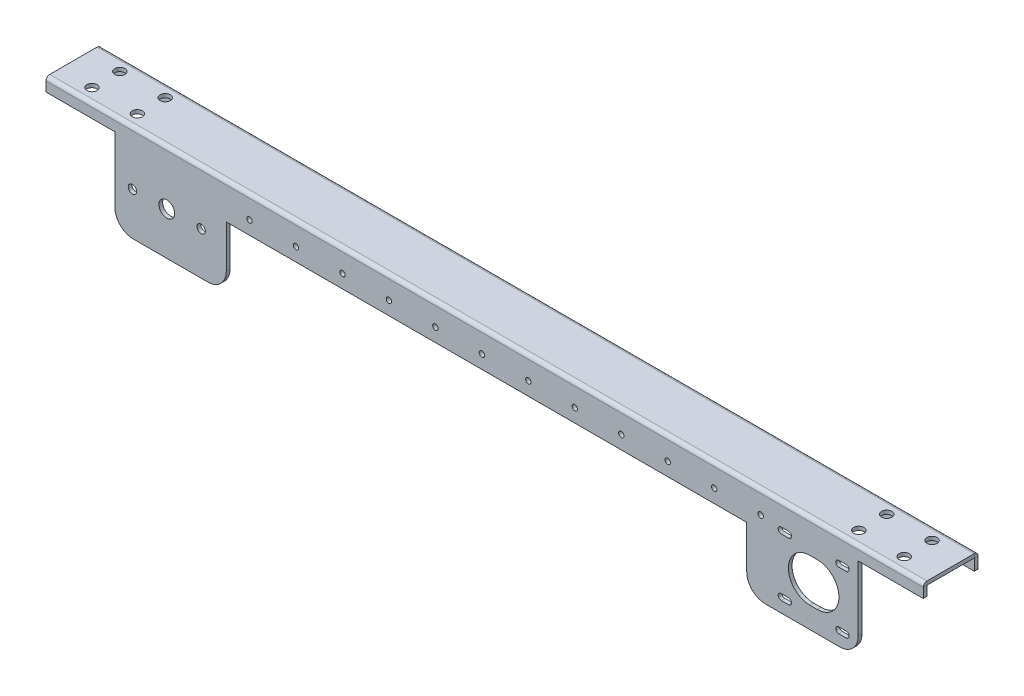
from build123d import *

# Parameters (mm, degrees)
BOSS_EXTRUDE1_DEPTH        = 2
SKETCH2_W                  = 400
SKETCH2_H                  = 2
BOSS_EXTRUDE2_DEPTH        = 37
CUT_EXTRUDE7_REACH         = 217.461
SKETCH32_W                 = 50
SKETCH32_H                 = 10
SKETCH35_W                 = 37
SKETCH35_H                 = 40
BOSS_EXTRUDE7_DEPTH        = 2
SKETCHED_START             = -237
SKETCHED_BEND1_DEPTH       = 472
SKETCHED_BEND1_2_DEPTH     = 472
SKETCHED_START_2           = -200
SKETCHED_BEND1_3_OUTLINE_W = 10
SKETCHED_BEND1_3_OUTLINE_H = 2
SKETCHED_BEND1_3_DEPTH     = 350
SKETCH24_W                 = 300
SKETCH24_H                 = 12
CUT_EXTRUDE4_DEPTH         = 1
CUT_EXTRUDE5_REACH         = 243.721
SKETCH25_R                 = 4.25
SKETCH30_W                 = 300
SKETCH30_H                 = 12
BOSS_EXTRUDE6_DEPTH        = 1
M3_5_TAPPED_HOLE1_D        = 2.9
LPATTERN1_COUNT            = 12
LPATTERN1_PITCH            = 25
SKETCH31_R                 = 2.25
CUT_EXTRUDE6_DEPTH         = 242.485502568
CUT_EXTRUDE8_REACH         = 246.229
SKETCH38_R                 = 2.75


# Read off the part's stored shape, not the designer's step: Sketched Bend1
with BuildPart() as part:
    # Sketch1 → Boss-Extrude1 (new body)
    with BuildSketch(Plane.XY):
        with BuildLine():
            Line((-190, -14.879809267), (-150, -14.879809267))
            ThreePointArc((-150, -14.879809267), (-142.928932188, -11.950877079), (-140, -4.879809267))
            Line((-140, -4.879809267), (-140, 18.120190733))
            Line((-140, 18.120190733), (140, 18.120190733))
            Line((140, 18.120190733), (140, -4.879809267))
            ThreePointArc((140, -4.879809267), (142.928932188, -11.950877079), (150, -14.879809267))
            Line((150, -14.879809267), (190, -14.879809267))
            ThreePointArc((190, -14.879809267), (197.071067812, -11.950877079), (200, -4.879809267))
            Line((200, -4.879809267), (200, 43.120190733))
            Line((200, 43.120190733), (-200, 43.120190733))
            Line((-200, 43.120190733), (-200, -4.879809267))
            ThreePointArc((-200, -4.879809267), (-197.071067812, -11.950877079), (-190, -14.879809267))
        make_face()
        with BuildLine():
            Line((178, 19.720190733), (174, 19.720190733))
            ThreePointArc((174, 19.720190733), (162.4, 8.120190733), (174, -3.479809267))
            Line((174, -3.479809267), (178, -3.479809267))
            ThreePointArc((178, -3.479809267), (189.6, 8.120190733), (178, 19.720190733))
        make_face(mode=Mode.SUBTRACT)
        with BuildLine():
            Line((158.5, -5.779809267), (162.5, -5.779809267))
            ThreePointArc((162.5, -5.779809267), (164.1, -7.379809267), (162.5, -8.979809267))
            Line((162.5, -8.979809267), (158.5, -8.979809267))
            ThreePointArc((158.5, -8.979809267), (156.9, -7.379809267), (158.5, -5.779809267))
        make_face(mode=Mode.SUBTRACT)
        with BuildLine():
            Line((193.5, -5.779809267), (189.5, -5.779809267))
            ThreePointArc((189.5, -5.779809267), (187.9, -7.379809267), (189.5, -8.979809267))
            Line((189.5, -8.979809267), (193.5, -8.979809267))
            ThreePointArc((193.5, -8.979809267), (195.1, -7.379809267), (193.5, -5.779809267))
        make_face(mode=Mode.SUBTRACT)
        with BuildLine():
            Line((193.5, 25.220190733), (189.5, 25.220190733))
            ThreePointArc((189.5, 25.220190733), (187.9, 23.620190733), (189.5, 22.020190733))
            Line((189.5, 22.020190733), (193.5, 22.020190733))
            ThreePointArc((193.5, 22.020190733), (195.1, 23.620190733), (193.5, 25.220190733))
        make_face(mode=Mode.SUBTRACT)
        with BuildLine():
            Line((158.5, 25.220190733), (162.5, 25.220190733))
            ThreePointArc((162.5, 25.220190733), (164.1, 23.620190733), (162.5, 22.020190733))
            Line((162.5, 22.020190733), (158.5, 22.020190733))
            ThreePointArc((158.5, 22.020190733), (156.9, 23.620190733), (158.5, 25.220190733))
        make_face(mode=Mode.SUBTRACT)
    extrude(amount=BOSS_EXTRUDE1_DEPTH)

    # Sketch2 → Boss-Extrude2 (add)
    with BuildSketch(Plane(origin=(0, 43.120190733, 40.120190733), x_dir=(-1, 0, 0), z_dir=(0, -1, 0))):
        with Locations((0, 39.120190733)):
            Rectangle(SKETCH2_W, SKETCH2_H)
    extrude(amount=-BOSS_EXTRUDE2_DEPTH)

    # Sketch32 → Cut-Extrude7 (cut, up to next)
    with BuildSketch(Plane.XY.offset(2), mode=Mode.PRIVATE) as cut_extrude7_sk1:
        with Locations((175, 75.120190733)):
            Rectangle(SKETCH32_W, SKETCH32_H)
    cut_extrude7_tool1 = extrude(cut_extrude7_sk1.sketch, amount=-CUT_EXTRUDE7_REACH, mode=Mode.PRIVATE) & part.part
    add(cut_extrude7_tool1.solids().sort_by_distance((175, 75.120191, 2))[0], mode=Mode.SUBTRACT)

    # Sketch35 → Boss-Extrude7 (add)
    with BuildSketch(Plane(origin=(0, 0, 0), x_dir=(-1, 0, 0), z_dir=(0, 0, -1))):
        with Locations((-216.5, 50.120190733)):
            Rectangle(SKETCH35_W, SKETCH35_H)
        with Locations((218.5, 50.120190733)):
            Rectangle(SKETCH35_W, SKETCH35_H)
    extrude(amount=-BOSS_EXTRUDE7_DEPTH)

    # Sketched Bend1 outline → Sketched Bend1 (cut)
    with BuildSketch(Plane.YZ.offset(SKETCHED_START)):
        with BuildLine():
            ThreePointArc((35.33479257, 2), (36.749006132, 1.414213562), (37.33479257, 0))
            Line((37.33479257, 0), (80.120190733, 0))
            Line((80.120190733, 0), (80.120190733, 2))
            Line((80.120190733, 2), (35.33479257, 2))
        make_face()
    extrude(amount=SKETCHED_BEND1_DEPTH, mode=Mode.SUBTRACT)

    # Sketched Bend1 2 outline → Sketched Bend1 2 (add)
    with BuildSketch(Plane.YZ.offset(SKETCHED_START)):
        with BuildLine():
            ThreePointArc((35.33479257, -27.429203673), (36.749006132, -26.843417235), (37.33479257, -25.429203673))
            Line((37.33479257, -25.429203673), (37.33479257, 0))
            Line((37.33479257, 0), (35.33479257, 0))
            Line((35.33479257, 0), (35.33479257, -25.429203673))
            Line((35.33479257, -25.429203673), (29.120190733, -25.429203673))
            Line((29.120190733, -25.429203673), (29.120190733, -27.429203673))
            Line((29.120190733, -27.429203673), (35.33479257, -27.429203673))
        make_face()
    extrude(amount=SKETCHED_BEND1_2_DEPTH)

    # Sketched Bend1 3 outline → Sketched Bend1 3 (add)
    with BuildSketch(Plane.YZ.offset(SKETCHED_START_2)):
        with Locations((24.120190733, -26.429203673)):
            Rectangle(SKETCHED_BEND1_3_OUTLINE_W, SKETCHED_BEND1_3_OUTLINE_H)
    extrude(amount=SKETCHED_BEND1_3_DEPTH)

    # Sketch24 → Cut-Extrude4 (cut)
    with BuildSketch(Plane.XY.offset(2)):
        with Locations((0, 27.33479257)):
            Rectangle(SKETCH24_W, SKETCH24_H)
    extrude(amount=-CUT_EXTRUDE4_DEPTH, mode=Mode.SUBTRACT)

    # Sketch25 → Cut-Extrude5 (cut, up to next)
    with BuildSketch(Plane.XY.offset(2), mode=Mode.PRIVATE) as cut_extrude5_sk1:
        with Locations((-172, 8.120190733)):
            Circle(SKETCH25_R)
    cut_extrude5_tool1 = extrude(cut_extrude5_sk1.sketch, amount=-CUT_EXTRUDE5_REACH, mode=Mode.PRIVATE) & part.part
    add(cut_extrude5_tool1.solids().sort_by_distance((-172, 8.120191, 2))[0], mode=Mode.SUBTRACT)

    # Sketch30 → Boss-Extrude6 (add)
    with BuildSketch(Plane.XY.offset(1)):
        with Locations((0, 27.33479257)):
            Rectangle(SKETCH30_W, SKETCH30_H)
    extrude(amount=BOSS_EXTRUDE6_DEPTH)

    # M3.5 Tapped Hole1 (through all)
    with Locations(Plane(origin=(-127.5, 25.33479257, 2), x_dir=(1, 0, 0), z_dir=(0, 0, 1))):
        with Locations((0, 0)):
            m3_5_tapped_hole1 = Hole(M3_5_TAPPED_HOLE1_D / 2)

    # LPattern1: M3.5 Tapped Hole1 ×12
    with Locations(*[(i * LPATTERN1_PITCH, 0, 0) for i in range(1, LPATTERN1_COUNT)]):
        add(m3_5_tapped_hole1, mode=Mode.SUBTRACT)

    # Sketch31 → Cut-Extrude6 (cut, through all)
    with BuildSketch(Plane(origin=(0, 0, 0), x_dir=(-1, 0, 0), z_dir=(0, 0, -1))):
        with Locations((190.5, 8.120190733)):
            Circle(SKETCH31_R)
        with Locations((153.5, 8.120190733)):
            Circle(SKETCH31_R)
    extrude(amount=-CUT_EXTRUDE6_DEPTH, mode=Mode.SUBTRACT)

    # Sketch38 → Cut-Extrude8 (cut, up to next)
    with BuildSketch(Plane(origin=(0, 37.33479257, 0), x_dir=(1, 0, 0), z_dir=(0, 1, 0)), mode=Mode.PRIVATE) as cut_extrude8_sk1:
        with Locations(Location((193.10140085, 5.229203673, 0), (0, 0, 270))):
            Circle(SKETCH38_R)
    cut_extrude8_tool1 = extrude(cut_extrude8_sk1.sketch, amount=-CUT_EXTRUDE8_REACH, mode=Mode.PRIVATE) & part.part
    # Sketch38 → Cut-Extrude8 (cut, up to next)
    with BuildSketch(Plane(origin=(0, 37.33479257, 0), x_dir=(1, 0, 0), z_dir=(0, 1, 0)), mode=Mode.PRIVATE) as cut_extrude8_sk2:
        with Locations(Location((193.10140085, 20.229203673, 0), (0, 0, 270))):
            Circle(SKETCH38_R)
    cut_extrude8_tool2 = extrude(cut_extrude8_sk2.sketch, amount=-CUT_EXTRUDE8_REACH, mode=Mode.PRIVATE) & part.part
    # Sketch38 → Cut-Extrude8 (cut, up to next)
    with BuildSketch(Plane(origin=(0, 37.33479257, 0), x_dir=(1, 0, 0), z_dir=(0, 1, 0)), mode=Mode.PRIVATE) as cut_extrude8_sk3:
        with Locations(Location((217.5, 20.229203673, 0), (0, 0, 270))):
            Circle(SKETCH38_R)
    cut_extrude8_tool3 = extrude(cut_extrude8_sk3.sketch, amount=-CUT_EXTRUDE8_REACH, mode=Mode.PRIVATE) & part.part
    # Sketch38 → Cut-Extrude8 (cut, up to next)
    with BuildSketch(Plane(origin=(0, 37.33479257, 0), x_dir=(1, 0, 0), z_dir=(0, 1, 0)), mode=Mode.PRIVATE) as cut_extrude8_sk4:
        with Locations(Location((217.5, 5.229203673, 0), (0, 0, 270))):
            Circle(SKETCH38_R)
    cut_extrude8_tool4 = extrude(cut_extrude8_sk4.sketch, amount=-CUT_EXTRUDE8_REACH, mode=Mode.PRIVATE) & part.part
    # Sketch38 → Cut-Extrude8 (cut, up to next)
    with BuildSketch(Plane(origin=(0, 37.33479257, 0), x_dir=(1, 0, 0), z_dir=(0, 1, 0)), mode=Mode.PRIVATE) as cut_extrude8_sk5:
        with Locations(Location((-219.5, 5.229203673, 0), (0, 0, 270))):
            Circle(SKETCH38_R)
    cut_extrude8_tool5 = extrude(cut_extrude8_sk5.sketch, amount=-CUT_EXTRUDE8_REACH, mode=Mode.PRIVATE) & part.part
    # Sketch38 → Cut-Extrude8 (cut, up to next)
    with BuildSketch(Plane(origin=(0, 37.33479257, 0), x_dir=(1, 0, 0), z_dir=(0, 1, 0)), mode=Mode.PRIVATE) as cut_extrude8_sk6:
        with Locations(Location((-219.5, 20.229203673, 0), (0, 0, 270))):
            Circle(SKETCH38_R)
    cut_extrude8_tool6 = extrude(cut_extrude8_sk6.sketch, amount=-CUT_EXTRUDE8_REACH, mode=Mode.PRIVATE) & part.part
    # Sketch38 → Cut-Extrude8 (cut, up to next)
    with BuildSketch(Plane(origin=(0, 37.33479257, 0), x_dir=(1, 0, 0), z_dir=(0, 1, 0)), mode=Mode.PRIVATE) as cut_extrude8_sk7:
        with Locations(Location((-195.10140085, 20.229203673, 0), (0, 0, 270))):
            Circle(SKETCH38_R)
    cut_extrude8_tool7 = extrude(cut_extrude8_sk7.sketch, amount=-CUT_EXTRUDE8_REACH, mode=Mode.PRIVATE) & part.part
    # Sketch38 → Cut-Extrude8 (cut, up to next)
    with BuildSketch(Plane(origin=(0, 37.33479257, 0), x_dir=(1, 0, 0), z_dir=(0, 1, 0)), mode=Mode.PRIVATE) as cut_extrude8_sk8:
        with Locations(Location((-195.10140085, 5.229203673, 0), (0, 0, 270))):
            Circle(SKETCH38_R)
    cut_extrude8_tool8 = extrude(cut_extrude8_sk8.sketch, amount=-CUT_EXTRUDE8_REACH, mode=Mode.PRIVATE) & part.part
    add(cut_extrude8_tool1.solids().sort_by_distance((193.101401, 37.334793, -5.229204))[0], mode=Mode.SUBTRACT)
    add(cut_extrude8_tool2.solids().sort_by_distance((193.101401, 37.334793, -20.229204))[0], mode=Mode.SUBTRACT)
    add(cut_extrude8_tool3.solids().sort_by_distance((217.5, 37.334793, -20.229204))[0], mode=Mode.SUBTRACT)
    add(cut_extrude8_tool4.solids().sort_by_distance((217.5, 37.334793, -5.229204))[0], mode=Mode.SUBTRACT)
    add(cut_extrude8_tool5.solids().sort_by_distance((-219.5, 37.334793, -5.229204))[0], mode=Mode.SUBTRACT)
    add(cut_extrude8_tool6.solids().sort_by_distance((-219.5, 37.334793, -20.229204))[0], mode=Mode.SUBTRACT)
    add(cut_extrude8_tool7.solids().sort_by_distance((-195.101401, 37.334793, -20.229204))[0], mode=Mode.SUBTRACT)
    add(cut_extrude8_tool8.solids().sort_by_distance((-195.101401, 37.334793, -5.229204))[0], mode=Mode.SUBTRACT)


solid = part.part
